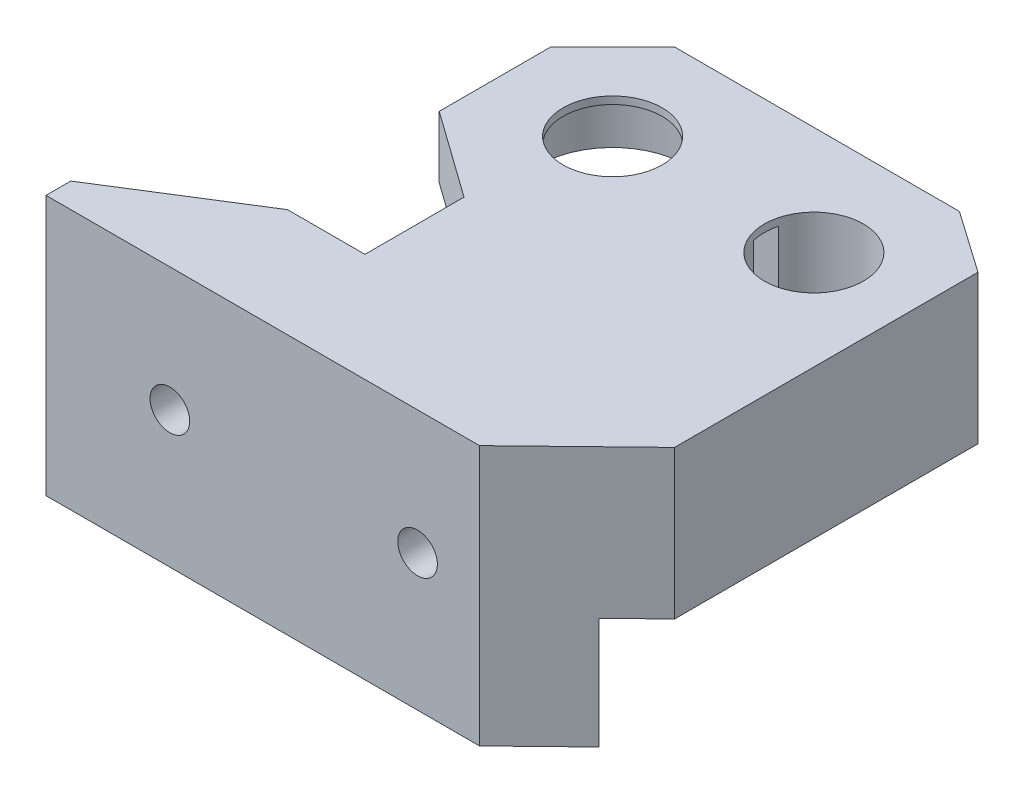
from build123d import *

# Parameters (mm, degrees)
SKETCH1_R           = 4
BOSS_EXTRUDE1_DEPTH = 5
BOSS_EXTRUDE2_DEPTH = 7
BOSS_EXTRUDE3_DEPTH = 16
BOSS_EXTRUDE4_START = 2.5
SKETCH6_R           = 7
SKETCH6_R_2         = 4
BOSS_EXTRUDE4_DEPTH = 2.5
CUT_EXTRUDE1_DEPTH  = 4.4
CUT_EXTRUDE2_DEPTH  = 42.631988903
SKETCH8_R           = 1.6
CUT_EXTRUDE3_DEPTH  = 47.066527979
SKETCH9_R           = 3
CUT_EXTRUDE4_DEPTH  = 4


with BuildPart() as part:
    # Sketch1 → Boss-Extrude1 (new body)
    with BuildSketch(Plane(origin=(0, 0, 0), x_dir=(1, 0, 0), z_dir=(0, 1, 0))):
        Polygon((-3.75, 8.75), (19.25, 8.75), (24.25, 5.25), (24.25, -19.25), (16.25, -27), (-18.75, -27), (-18.75, -25), (-8, -18.25), (-1.75, -18.25), (-1.75, -10.25), (-8.75, -5.25), (-8.75, 3.75), align=None)
        Circle(SKETCH1_R, mode=Mode.SUBTRACT)
        with Locations((16.25, 0)):
            Circle(SKETCH1_R, mode=Mode.SUBTRACT)
    extrude(amount=BOSS_EXTRUDE1_DEPTH)

    # Sketch2 → Boss-Extrude2 (add)
    with BuildSketch(Plane.XZ):
        Polygon((24.25, 19.25), (24.25, -5.25), (20.75, -5.25), (20.75, 18.25), (-8, 18.25), (-14.37037037, 22.25), (21.153225806, 22.25), align=None)
    extrude(amount=BOSS_EXTRUDE2_DEPTH)

    # Sketch3 → Boss-Extrude3 (add)
    with BuildSketch(Plane.XZ):
        Polygon((-14.37037037, 22.25), (21.153225806, 22.25), (16.25, 27), (-18.75, 27), (-18.75, 25), align=None)
    extrude(amount=BOSS_EXTRUDE3_DEPTH)

    # Sketch6 → Boss-Extrude4 (add)
    with BuildSketch(Plane.XZ.offset(BOSS_EXTRUDE4_START)):
        with Locations((16.25, 0)):
            Circle(SKETCH6_R)
        with Locations((16.25, 0)):
            Circle(SKETCH6_R_2, mode=Mode.SUBTRACT)
    extrude(amount=-BOSS_EXTRUDE4_DEPTH)

    # Sketch4 → Cut-Extrude1 (cut)
    with BuildSketch(Plane.XZ):
        with BuildLine():
            Line((5.883782294, -1), (12.377016654, -1))
            ThreePointArc((12.377016654, -1), (12.25, 0), (12.377016654, 1))
            Line((12.377016654, 1), (5.883782294, 1))
            ThreePointArc((5.883782294, 1), (-5.968156673, 0), (5.883782294, -1))
        make_face()
    extrude(amount=-CUT_EXTRUDE1_DEPTH, mode=Mode.SUBTRACT)

    # Sketch7 → Cut-Extrude2 (cut, through all)
    with BuildSketch(Plane.XZ.offset(-4.4)):
        with BuildLine():
            Line((5.883782294, -1), (12.377016654, -1))
            ThreePointArc((12.377016654, -1), (12.25, 0), (12.377016654, 1))
            Line((12.377016654, 1), (5.883782294, 1))
            ThreePointArc((5.883782294, 1), (-5.968156673, 0), (5.883782294, -1))
        make_face()
    extrude(amount=CUT_EXTRUDE2_DEPTH, mode=Mode.SUBTRACT)

    # Sketch8 → Cut-Extrude3 (cut, through all)
    with BuildSketch(Plane.XY.offset(27)):
        with Locations((11.25, -5)):
            Circle(SKETCH8_R)
        with Locations((-8.75, -5)):
            Circle(SKETCH8_R)
    extrude(amount=-CUT_EXTRUDE3_DEPTH, mode=Mode.SUBTRACT)

    # Sketch9 → Cut-Extrude4 (cut)
    with BuildSketch(Plane(origin=(0, 0, 18.25), x_dir=(-1, 0, 0), z_dir=(0, 0, -1))):
        with Locations((-11.25, -5)):
            Circle(SKETCH9_R)
        with Locations((8.75, -5)):
            Circle(SKETCH9_R)
    extrude(amount=-CUT_EXTRUDE4_DEPTH, mode=Mode.SUBTRACT)


solid = part.part
